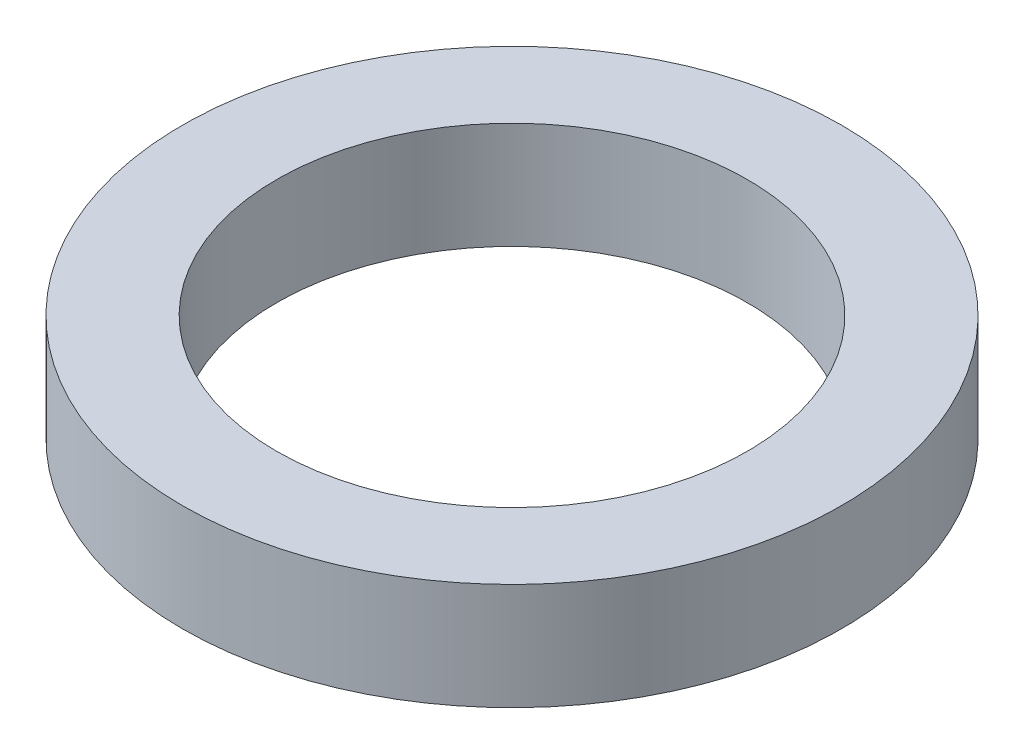
from build123d import *

# Parameters (mm, degrees)
SKETCH1_R           = 52.5
BOSS_EXTRUDE1_DEPTH = 17
SKETCH2_R           = 37.5
CUT_EXTRUDE1_DEPTH  = 77.167578404


with BuildPart() as part:
    # Sketch1 → Boss-Extrude1 (new body)
    with BuildSketch(Plane(origin=(0, 0, 0), x_dir=(1, 0, 0), z_dir=(0, 1, 0))):
        Circle(SKETCH1_R)
    extrude(amount=BOSS_EXTRUDE1_DEPTH)

    # Sketch2 → Cut-Extrude1 (cut, through all)
    with BuildSketch(Plane(origin=(0, 0, 0), x_dir=(1, 0, 0), z_dir=(0, 1, 0))):
        Circle(SKETCH2_R)
    extrude(amount=CUT_EXTRUDE1_DEPTH, mode=Mode.SUBTRACT)


solid = part.part
